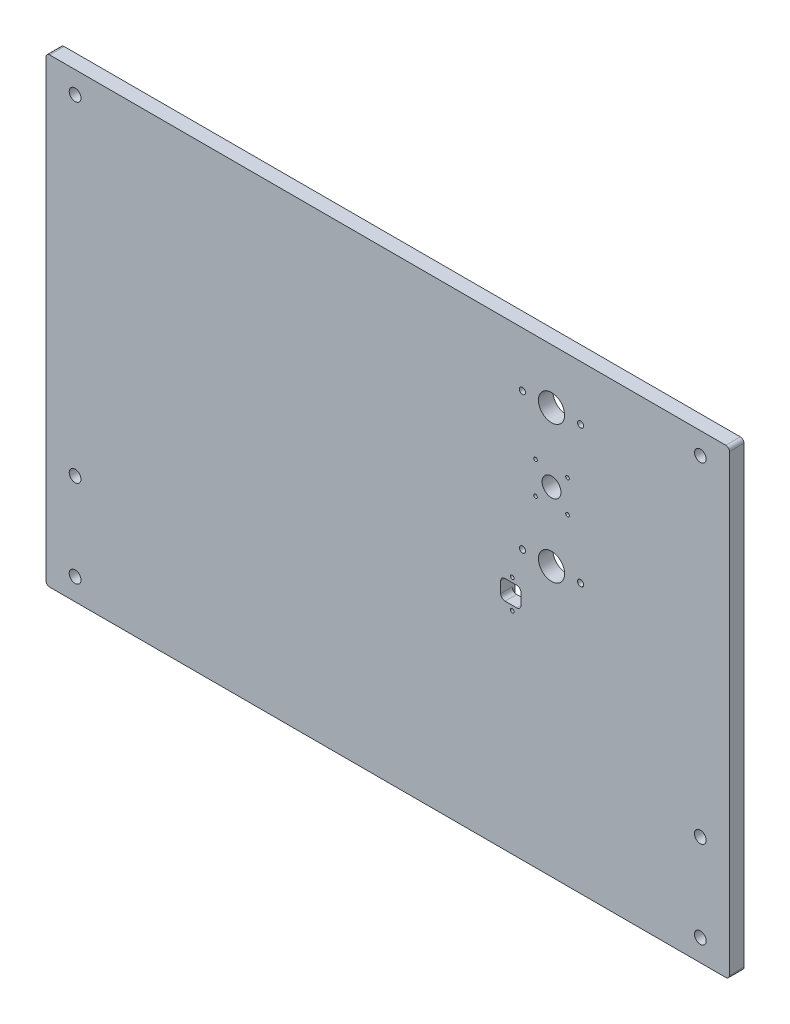
from build123d import *

# Parameters (mm, degrees)
SKETCH2_W             = 470
SKETCH2_H             = 317
BOSS_EXTRUDE1_DEPTH   = 5
SKETCH3_R             = 4.05
CUT_EXTRUDE1_DEPTH    = 10
SKETCH4_R             = 9
CUT_EXTRUDE2_DEPTH    = 284.632244288
M5X0_8_TAPPED_HOLE1_D = 4.2
SKETCH10_R            = 4
CUT_EXTRUDE8_DEPTH    = 284.632244288
SKETCH11_R            = 6.5
CUT_EXTRUDE9_DEPTH    = 284.632244288
M3X0_5_TAPPED_HOLE1_D = 2.5
SKETCH20_W            = 14
SKETCH20_H            = 30
CUT_EXTRUDE11_DEPTH   = 2
M3X0_5_TAPPED_HOLE2_D = 2.5
SKETCH23_W            = 14
SKETCH23_H            = 13.5
CUT_EXTRUDE13_DEPTH   = 284.568774727
FILLET1_R             = 3
FILLET2_R             = 2.5


with BuildPart() as part:
    # Sketch2 → Boss-Extrude1 (new, symmetric)
    with BuildSketch(Plane.XY):
        Rectangle(SKETCH2_W, SKETCH2_H)
    extrude(amount=BOSS_EXTRUDE1_DEPTH, both=True)

    # Sketch3 → Cut-Extrude1 (cut)
    with BuildSketch(Plane.XY.offset(5)):
        with Locations((-215, -83.5)):
            Circle(SKETCH3_R)
        with Locations((-215, -143.5)):
            Circle(SKETCH3_R)
        with Locations((215, -83.5)):
            Circle(SKETCH3_R)
        with Locations((215, -143.5)):
            Circle(SKETCH3_R)
        with Locations((-215, 143.5)):
            Circle(SKETCH3_R)
    extrude(amount=-CUT_EXTRUDE1_DEPTH, mode=Mode.SUBTRACT)

    # Sketch4 → Cut-Extrude2 (cut, through all)
    with BuildSketch(Plane.XY.offset(5)):
        with Locations((112.65, 121)):
            Circle(SKETCH4_R)
        with Locations((112.65, 26.5)):
            Circle(SKETCH4_R)
    extrude(amount=-CUT_EXTRUDE2_DEPTH, mode=Mode.SUBTRACT)

    # M5x0.8 Tapped Hole1 (through all)
    with Locations(Plane.XY.offset(5)):
        with Locations((132.65, 121), (92.65, 121), (92.65, 26.5), (132.65, 26.5)):
            Hole(M5X0_8_TAPPED_HOLE1_D / 2)

    # Sketch10 → Cut-Extrude8 (cut, through all)
    with BuildSketch(Plane.XY.offset(5)):
        with Locations((215, 143.5)):
            Circle(SKETCH10_R)
    extrude(amount=-CUT_EXTRUDE8_DEPTH, mode=Mode.SUBTRACT)

    # Sketch11 → Cut-Extrude9 (cut, through all)
    with BuildSketch(Plane.XY.offset(5)):
        with Locations((112.65, 73.75)):
            Circle(SKETCH11_R)
    extrude(amount=-CUT_EXTRUDE9_DEPTH, mode=Mode.SUBTRACT)

    # M3x0.5 Tapped Hole1 (through all)
    with Locations(Plane.XY.offset(5)):
        with Locations((101.65, 84.75), (123.65, 84.75), (123.65, 62.75), (101.65, 62.75)):
            Hole(M3X0_5_TAPPED_HOLE1_D / 2)

    # Sketch20 → Cut-Extrude11 (cut)
    with BuildSketch(Plane.XY.offset(-5)):
        with Locations((84.65, -3.5)):
            Rectangle(SKETCH20_W, SKETCH20_H)
    extrude(amount=CUT_EXTRUDE11_DEPTH, mode=Mode.SUBTRACT)

    # M3x0.5 Tapped Hole2 (through all)
    with Locations(Plane(origin=(0, 0, -3), x_dir=(-1, 0, 0), z_dir=(0, 0, -1))):
        with Locations((-85.65, 6.5), (-85.65, -13.5)):
            Hole(M3X0_5_TAPPED_HOLE2_D / 2)

    # Sketch23 → Cut-Extrude13 (cut, through all)
    with BuildSketch(Plane(origin=(0, 0, -3), x_dir=(-1, 0, 0), z_dir=(0, 0, -1))):
        with Locations((-84.65, -3.5)):
            Rectangle(SKETCH23_W, SKETCH23_H)
    extrude(amount=-CUT_EXTRUDE13_DEPTH, mode=Mode.SUBTRACT)

    # Fillet1
    fillet1_edges = [part.edges().sort_by_distance(p)[0] for p in [
        (91.65, -18.5, -4),
        (77.65, -18.5, -4),
        (77.65, 11.5, -4),
        (91.65, 11.5, -4),
        (77.65, -10.25, 1),
        (77.65, 3.25, 1),
        (91.65, 3.25, 1),
        (91.65, -10.25, 1),
    ]]
    fillet(fillet1_edges, radius=FILLET1_R)

    # Fillet2
    fillet2_edges = [part.edges().sort_by_distance(p)[0] for p in [
        (-235, -158.5, 0),
        (235, -158.5, 0),
        (235, 158.5, 0),
        (-235, 158.5, 0),
    ]]
    fillet(fillet2_edges, radius=FILLET2_R)


solid = part.part
